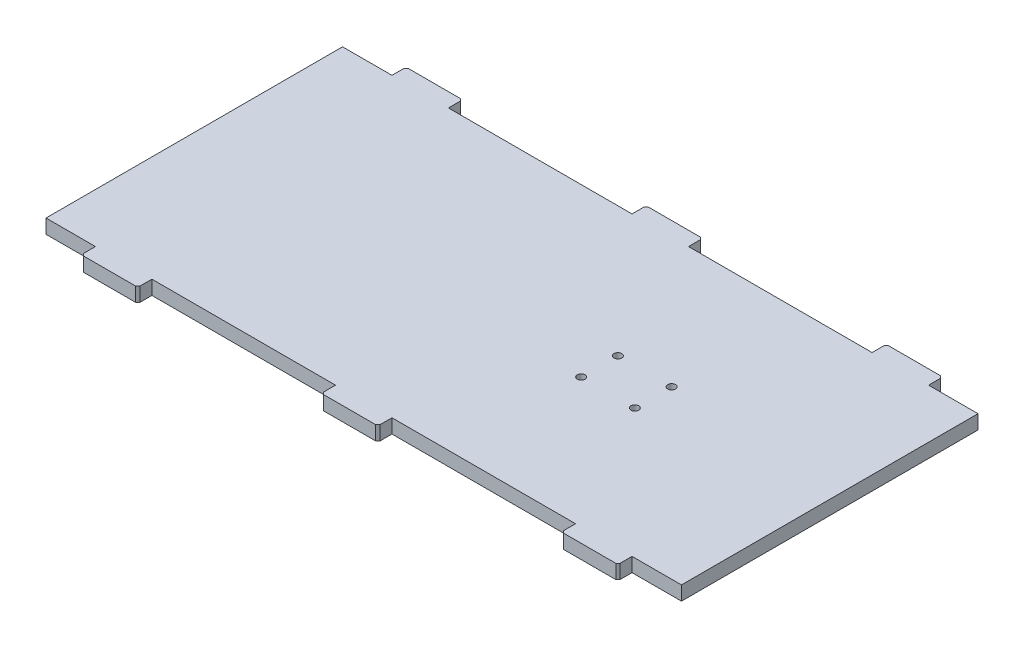
from build123d import *

# Parameters (mm, degrees)
SKETCH_1_W                       = 450
SKETCH_1_H                       = 210
EXTRUDE_797_DEPTH                = 5
SKETCH_2_W                       = 40
SKETCH_2_H                       = 10
EXTRUDE_849_DEPTH                = 5
CHAMFER_897_SIZE                 = 1.5
SKETCH_3_W                       = 40
SKETCH_3_H                       = 10
EXTRUDE_968_DEPTH                = 5
CHAMFER_1013_SIZE                = 1.5
CHAMFER_1013_OF_MIRROR_1076_SIZE = 1.5
MIRROR_START                     = -5
MIRROR_1098_DEPTH                = 10
HOLE_WIZARD_1123_D               = 5.5
HOLE_WIZARD_1123_DEPTH           = 10
HOLE_WIZARD_1123_TIP             = 1.652366702


# Read off the part's stored shape, not the designer's step: ほぞ(左)
with BuildPart() as part:
    # ｽｹｯﾁ1 → Extrude 797 (new, symmetric)
    with BuildSketch(Plane(origin=(0, 0, 0), x_dir=(1, 0, 0), z_dir=(0, 1, 0))):
        Rectangle(SKETCH_1_W, SKETCH_1_H)
    extrude(amount=EXTRUDE_797_DEPTH, both=True)

    # ｽｹｯﾁ2 → Extrude 849 (add, symmetric)
    with BuildSketch(Plane(origin=(0, 0, 0), x_dir=(1, 0, 0), z_dir=(0, 1, 0))):
        with Locations((0, -110)):
            Rectangle(SKETCH_2_W, SKETCH_2_H)
    extrude(amount=EXTRUDE_849_DEPTH, both=True)

    # Chamfer 897
    chamfer_897_edges = [part.edges().sort_by_distance(p)[0] for p in [
        (-20, 0, 115),
        (20, 0, 115),
    ]]
    chamfer(chamfer_897_edges, length=CHAMFER_897_SIZE)

    # ｽｹｯﾁ3 → Extrude 968 (add, symmetric)
    with BuildSketch(Plane(origin=(0, 0, 0), x_dir=(1, 0, 0), z_dir=(0, 1, 0))):
        with Locations((170, -110)):
            Rectangle(SKETCH_3_W, SKETCH_3_H)
    extrude_968 = extrude(amount=EXTRUDE_968_DEPTH, both=True)

    # Chamfer 1013
    chamfer_1013_edges = [part.edges().sort_by_distance(p)[0] for p in [
        (150, 0, 115),
        (190, 0, 115),
    ]]
    chamfer(chamfer_1013_edges, length=CHAMFER_1013_SIZE)

    # Mirror 1076: Extrude 968 across plane
    add(extrude_968.mirror(Plane(origin=(0, 0, 0), x_dir=(0, 0, 1), z_dir=(1, 0, 0))))

    # Chamfer 1013 of Mirror 1076
    chamfer_1013_of_mirror_1076_edges = [part.edges().sort_by_distance(p)[0] for p in [
        (-150, 0, 115),
        (-190, 0, 115),
    ]]
    chamfer(chamfer_1013_of_mirror_1076_edges, length=CHAMFER_1013_OF_MIRROR_1076_SIZE)

    # Mirror 1098 outline → Mirror 1098 (add)
    with BuildSketch(Plane(origin=(0, 0, 0), x_dir=(1, 0, 0), z_dir=(0, 1, 0)).offset(MIRROR_START)):
        Polygon((-18.5, 115), (-20, 113.5), (-20, 105), (20, 105), (20, 113.5), (18.5, 115), align=None)
        Polygon((150, 113.5), (150, 105), (190, 105), (190, 113.5), (188.5, 115), (151.5, 115), align=None)
        Polygon((-190, 105), (-150, 105), (-150, 113.5), (-151.5, 115), (-188.5, 115), (-190, 113.5), align=None)
    extrude(amount=MIRROR_1098_DEPTH)

    # Hole Wizard 1123
    with Locations(Plane(origin=(0, 5, 0), x_dir=(1, 0, 0), z_dir=(0, 1, 0))):
        with Locations((100, -13), (100, 13), (62, -13), (62, 13)):
            Hole(HOLE_WIZARD_1123_D / 2, depth=HOLE_WIZARD_1123_DEPTH)
            with Locations((0, 0, -(HOLE_WIZARD_1123_DEPTH + HOLE_WIZARD_1123_TIP / 2))):  # 118° drill point
                Cone(0, HOLE_WIZARD_1123_D / 2, HOLE_WIZARD_1123_TIP, mode=Mode.SUBTRACT)


solid = part.part
